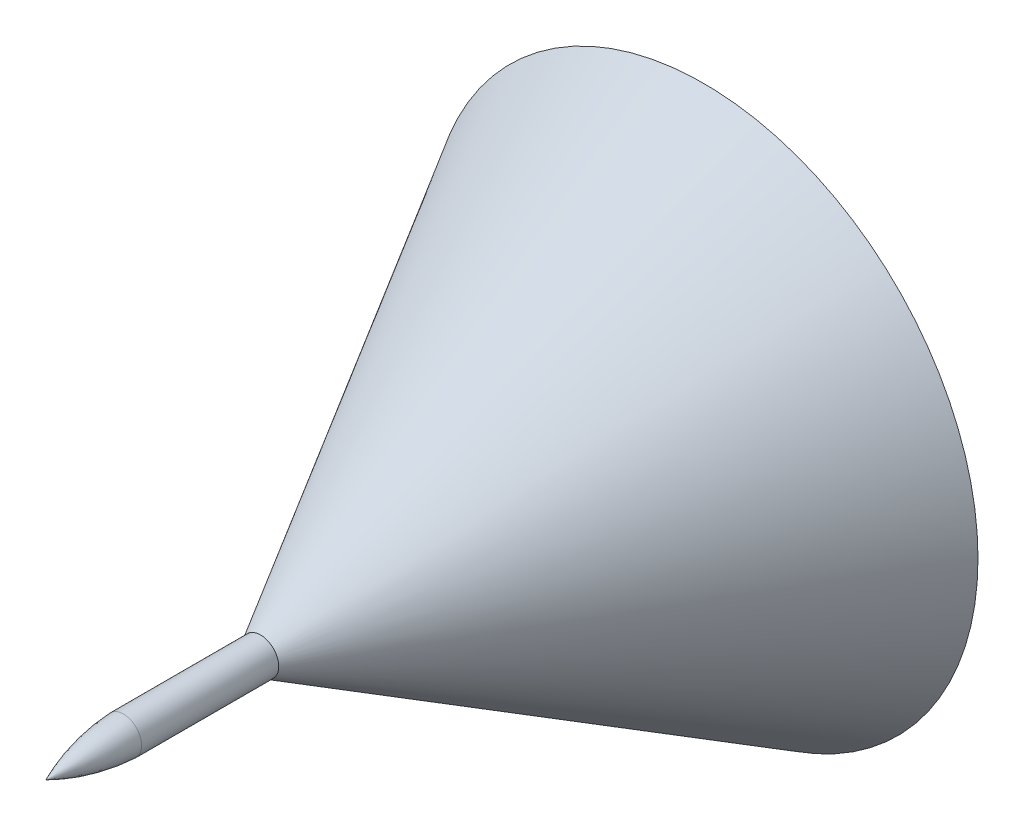
from build123d import *


with BuildPart() as part:
    # 草圖1 → 旋轉1 (revolve)
    with BuildSketch(Plane(origin=(0, 0, 0), x_dir=(0, 0, -1), z_dir=(1, 0, 0))):
        Polygon((0, 0), (25.980762114, 15), (25.980762114, 13.845299462), (2, 0), align=None)
    revolve(axis=Axis((0, 0, 0), (0, 0, -1)))

    # 草圖5 → 旋轉2 (revolve)
    with BuildSketch(Plane(origin=(0, 0, 0), x_dir=(1, 0, 0), z_dir=(0, 1, 0))):
        with BuildLine():
            Line((-1, -5.767949192), (-1, 1.732050808))
            Line((-1, 1.732050808), (0, 0))
            Line((0, 0), (0, -10))
            add(Edge.make_bspline(
                [(-1, -5.767949192), (-0.902479678, -7.979940758), (0, -10)],
                knots=[0, 0, 0, 1, 1, 1], degree=2))
        make_face()
    revolve(axis=Axis((0, 0, 0), (0, 0, 1)))


solid = part.part
